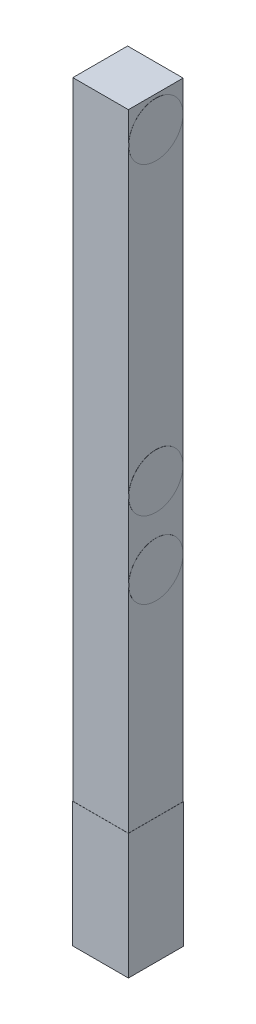
from build123d import *

# Parameters (mm, degrees)
SKETCH1_W           = 45.02
SKETCH1_H           = 44.376857142
BOSS_EXTRUDE1_DEPTH = 609.6
SKETCH2_R           = 22
BOSS_EXTRUDE2_DEPTH = 0.1
SKETCH3_W           = 44.376857142
SKETCH3_H           = 101.6
BOSS_EXTRUDE3_DEPTH = 0.1
SKETCH4_W           = 45.12
SKETCH4_H           = 101.6
BOSS_EXTRUDE4_DEPTH = 0.1
SKETCH5_W           = 44.476857142
SKETCH5_H           = 101.6
BOSS_EXTRUDE5_DEPTH = 0.1
SKETCH6_W           = 45.12
SKETCH6_H           = 101.6
BOSS_EXTRUDE6_DEPTH = 0.1


with BuildPart() as part:
    # Sketch1 → Boss-Extrude1 (new body)
    with BuildSketch(Plane(origin=(0, 0, 0), x_dir=(1, 0, 0), z_dir=(0, 1, 0))):
        Rectangle(SKETCH1_W, SKETCH1_H)
    extrude(amount=BOSS_EXTRUDE1_DEPTH)

    # Sketch2 → Boss-Extrude2 (add)
    with BuildSketch(Plane(origin=(22.51, 0, 0), x_dir=(0, 0, -1), z_dir=(1, 0, 0))):
        with Locations((0, 275.7)):
            Circle(SKETCH2_R)
        with Locations((0, 337.8)):
            Circle(SKETCH2_R)
        with Locations((0, 584.6)):
            Circle(SKETCH2_R)
    extrude(amount=BOSS_EXTRUDE2_DEPTH)

    # Sketch3 → Boss-Extrude3 (add)
    with BuildSketch(Plane(origin=(22.51, 0, 0), x_dir=(0, 0, -1), z_dir=(1, 0, 0))):
        with Locations((0, 50.8)):
            Rectangle(SKETCH3_W, SKETCH3_H)
    extrude(amount=BOSS_EXTRUDE3_DEPTH)

    # Sketch4 → Boss-Extrude4 (add)
    with BuildSketch(Plane(origin=(0, 0, -22.188428571), x_dir=(-1, 0, 0), z_dir=(0, 0, -1))):
        with Locations((-0.05, 50.8)):
            Rectangle(SKETCH4_W, SKETCH4_H)
    extrude(amount=BOSS_EXTRUDE4_DEPTH)

    # Sketch5 → Boss-Extrude5 (add)
    with BuildSketch(Plane.ZY.offset(22.51)):
        with Locations((-0.05, 50.8)):
            Rectangle(SKETCH5_W, SKETCH5_H)
    extrude(amount=BOSS_EXTRUDE5_DEPTH)

    # Sketch6 → Boss-Extrude6 (add)
    with BuildSketch(Plane.XY.offset(22.188428571)):
        with Locations((-0.05, 50.8)):
            Rectangle(SKETCH6_W, SKETCH6_H)
    extrude(amount=BOSS_EXTRUDE6_DEPTH)


solid = part.part
